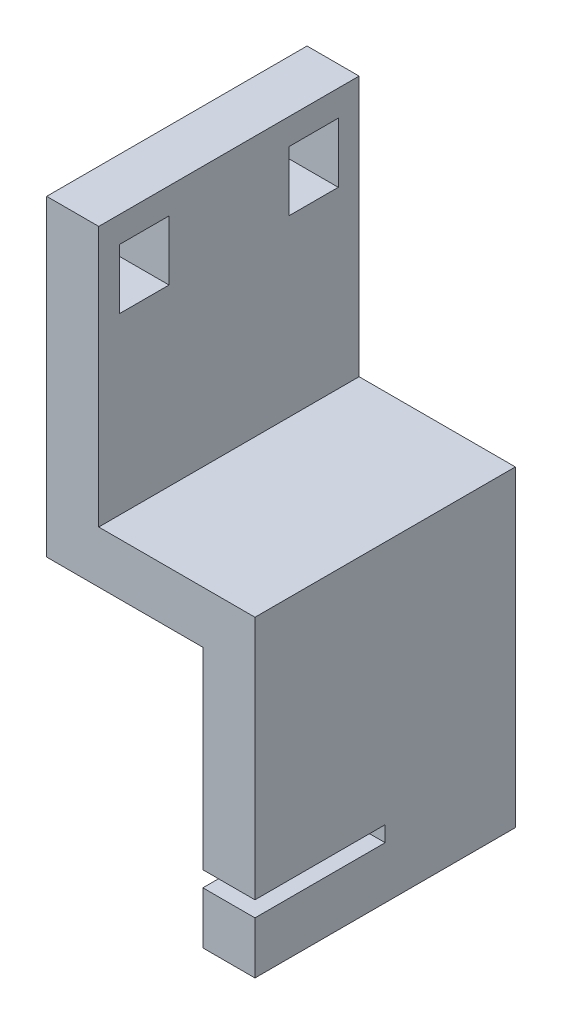
from build123d import *

# Parameters (mm, degrees)
BOSS_EXTRUDE1_DEPTH = 50
SKETCH2_W           = 25
SKETCH2_H           = 3
CUT_EXTRUDE1_DEPTH  = 128.279220614
SKETCH3_W           = 9.5
SKETCH3_H           = 11.5
CUT_EXTRUDE2_DEPTH  = 125.49899598


with BuildPart() as part:
    # Sketch1 → Boss-Extrude1 (new body)
    with BuildSketch(Plane.XY):
        Polygon((0, 0), (10, 0), (10, 5), (10, 8), (10, 60), (-20, 60), (-20, 110), (-30, 110), (-30, 50), (0, 50), align=None)
    extrude(amount=BOSS_EXTRUDE1_DEPTH)

    # Sketch2 → Cut-Extrude1 (cut, through all)
    with BuildSketch(Plane(origin=(10, 0, 0), x_dir=(0, 0, -1), z_dir=(1, 0, 0))):
        with Locations((-37.5, 11.5)):
            Rectangle(SKETCH2_W, SKETCH2_H)
    extrude(amount=-CUT_EXTRUDE1_DEPTH, mode=Mode.SUBTRACT)

    # Sketch3 → Cut-Extrude2 (cut, through all)
    with BuildSketch(Plane(origin=(-20, 0, 0), x_dir=(0, 0, -1), z_dir=(1, 0, 0))):
        with Locations((-8.75, 99.25)):
            Rectangle(SKETCH3_W, SKETCH3_H)
        with Locations((-41.25, 99.25)):
            Rectangle(SKETCH3_W, SKETCH3_H)
    extrude(amount=-CUT_EXTRUDE2_DEPTH, mode=Mode.SUBTRACT)


solid = part.part
